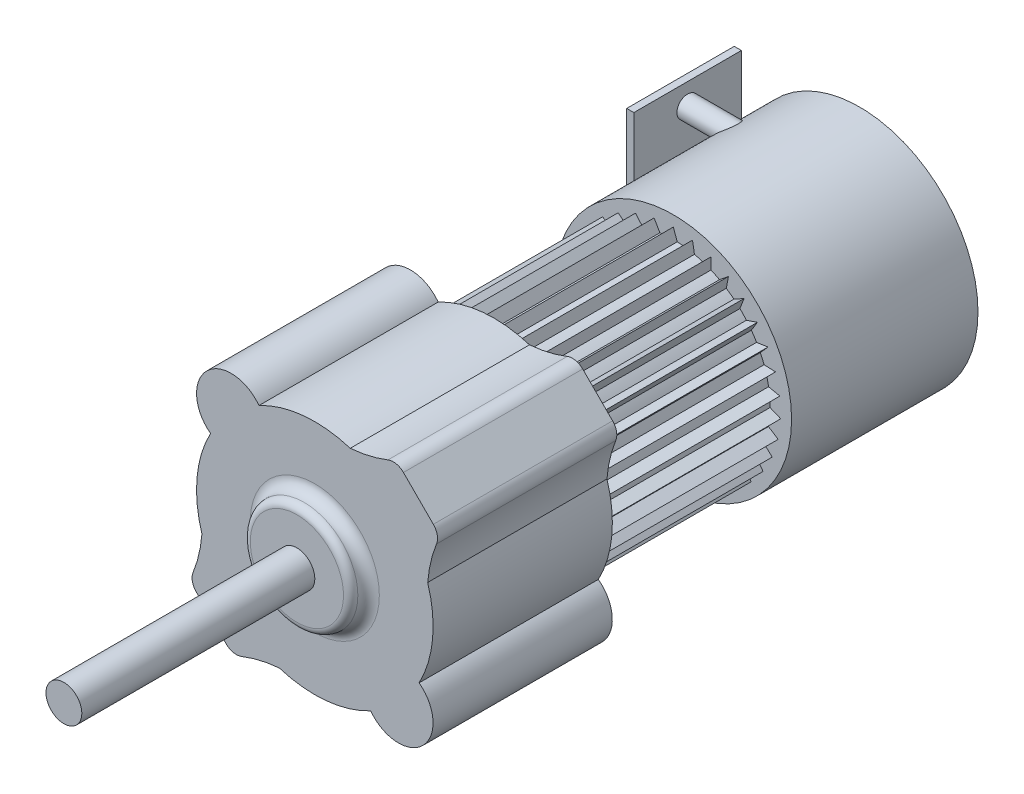
from build123d import *

# Parameters (mm, degrees)
BOSS_EXTRUDE1_DEPTH  = 25
FILLET1_R            = 2
BOSS_EXTRUDE2_DEPTH  = 25
BOSS_EXTRUDE5_START  = 26
SKETCH4_R            = 16.5
BOSS_EXTRUDE5_DEPTH  = 26
SKETCH6_W            = 1
SKETCH6_H            = 30.157972744
BOSS_EXTRUDE6_DEPTH  = 15
SKETCH7_R            = 1.5
BOSS_EXTRUDE9_DEPTH  = 15
SKETCH8_R            = 2.5
BOSS_EXTRUDE10_DEPTH = 35
SKETCH9_R            = 7.5
BOSS_EXTRUDE11_DEPTH = 2.5
FILLET2_R            = 1.5
FILLET3_R            = 1


with BuildPart() as part:
    # Sketch1 → Boss-Extrude1 (new body)
    with BuildSketch(Plane.XY):
        with BuildLine():
            Line((11.392014277, 17.5), (17.5, 11.392014277))
            add(Edge.make_bspline(
                [(17.5, 11.392014277), (16.021001263, 8.336734414), (15.743328656, 4.93939296)],
                knots=[0, 0, 0, 1, 1, 1], degree=2))
            ThreePointArc((15.743328656, 4.93939296), (16.427227325, -1.547967187), (14.54349702, -7.793375035))
            ThreePointArc((14.54349702, -7.793375035), (15.078986372, -15.078986372), (7.793375035, -14.54349702))
            ThreePointArc((7.793375035, -14.54349702), (1.547967187, -16.427227325), (-4.93939296, -15.743328656))
            add(Edge.make_bspline(
                [(-11.392014277, -17.5), (-8.336734414, -16.021001263), (-4.93939296, -15.743328656)],
                knots=[0, 0, 0, 1, 1, 1], degree=2))
            Line((-11.392014277, -17.5), (-17.5, -11.392014277))
            add(Edge.make_bspline(
                [(-17.5, -11.392014277), (-16.021001263, -8.336734414), (-15.743328656, -4.93939296)],
                knots=[0, 0, 0, 1, 1, 1], degree=2))
            ThreePointArc((-15.743328656, -4.93939296), (-16.427227325, 1.547967187), (-14.54349702, 7.793375035))
            ThreePointArc((-14.54349702, 7.793375035), (-15.078986372, 15.078986372), (-7.793375035, 14.54349702))
            ThreePointArc((-7.793375035, 14.54349702), (-1.547967187, 16.427227325), (4.93939296, 15.743328656))
            add(Edge.make_bspline(
                [(11.392014277, 17.5), (8.336734414, 16.021001263), (4.93939296, 15.743328656)],
                knots=[0, 0, 0, 1, 1, 1], degree=2))
        make_face()
    extrude(amount=BOSS_EXTRUDE1_DEPTH)

    # Fillet1
    fillet1_edges = [part.edges().sort_by_distance(p)[0] for p in [
        (-11.392014277, -17.5, 12.5),
        (-17.5, -11.392014277, 12.5),
        (17.5, 11.392014277, 12.5),
        (11.392014277, 17.5, 12.5),
    ]]
    fillet(fillet1_edges, radius=FILLET1_R)

    # Sketch3 → Boss-Extrude2 (add)
    with BuildSketch(Plane(origin=(0, 0, 0), x_dir=(-1, 0, 0), z_dir=(0, 0, -1))):
        with BuildLine():
            Line((-0.551967724, 13.488711267), (0, 15))
            Line((0, 15), (0.551967724, 13.488711267))
            ThreePointArc((0.551967724, 13.488711267), (1.21013067, 13.445652969), (1.865405023, 13.37049977))
            Line((1.865405023, 13.37049977), (2.678353422, 14.758943829))
            Line((2.678353422, 14.758943829), (2.951599775, 13.173384484))
            ThreePointArc((2.951599775, 13.173384484), (3.591497415, 13.013498619), (4.222822117, 12.82254941))
            Line((4.222822117, 12.82254941), (5.270622361, 14.04352306))
            Line((5.270622361, 14.04352306), (5.256364979, 12.434654286))
            ThreePointArc((5.256364979, 12.434654286), (5.857430478, 12.163079717), (6.444514235, 11.862471761))
            Line((6.444514235, 11.862471761), (7.693489161, 12.876731904))
            Line((7.693489161, 12.876731904), (7.392186289, 11.296264067))
            ThreePointArc((7.392186289, 11.296264067), (7.935100906, 10.921729424), (8.459074362, 10.521124509))
            Line((8.459074362, 10.521124509), (9.869080889, 11.29607199))
            Line((9.869080889, 11.29607199), (9.290416649, 9.794802627))
            ThreePointArc((9.290416649, 9.794802627), (9.757730662, 9.329345761), (10.201752879, 8.841619659))
            Line((10.201752879, 8.841619659), (11.727472237, 9.352347028))
            Line((11.727472237, 9.352347028), (10.890045373, 7.978528171))
            ThreePointArc((10.890045373, 7.978528171), (11.266738925, 7.43710925), (11.616538664, 6.877937878))
            Line((11.616538664, 6.877937878), (13.208932978, 7.108029937))
            Line((13.208932978, 7.108029937), (12.139659079, 5.905817254))
            ThreePointArc((12.139659079, 5.905817254), (12.413624929, 5.305837927), (12.657959339, 4.693193515))
            Line((12.657959339, 4.693193515), (14.265847744, 4.635254916))
            Line((14.265847744, 4.635254916), (12.999094154, 3.643288512))
            ThreePointArc((12.999094154, 3.643288512), (13.161526814, 3.004032608), (13.292542786, 2.35760605))
            Line((13.292542786, 2.35760605), (14.864246427, 2.013498987))
            Line((14.864246427, 2.013498987), (13.440727646, 1.26366148))
            ThreePointArc((13.440727646, 1.26366148), (13.486406398, 0.60567521), (13.49989297, -0.053756813))
            Line((13.49989297, -0.053756813), (14.984895998, -0.672972455))
            Line((14.984895998, -0.672972455), (13.450365093, -1.156580672))
            ThreePointArc((13.450365093, -1.156580672), (13.377821784, -1.812149089), (13.273345487, -2.463391888))
            Line((13.273345487, -2.463391888), (14.623918683, -3.337814009))
            Line((14.623918683, -3.337814009), (13.02769674, -3.53964937))
            ThreePointArc((13.02769674, -3.53964937), (12.83926297, -4.171729424), (12.620181758, -4.79385152))
            Line((12.620181758, -4.79385152), (13.792916588, -5.895375475))
            Line((13.792916588, -5.895375475), (12.186307493, -5.808950825))
            ThreePointArc((12.186307493, -5.808950825), (11.88803968, -6.397226943), (11.561395003, -6.970232821))
            Line((11.561395003, -6.970232821), (12.518598806, -8.263454722))
            Line((12.518598806, -8.263454722), (10.953240297, -7.89154782))
            ThreePointArc((10.953240297, -7.89154782), (10.554725013, -8.417112325), (10.131015501, -8.922585103))
            Line((10.131015501, -8.922585103), (10.841922957, -10.365939735))
            Line((10.841922957, -10.365939735), (9.368126945, -9.720503975))
            ThreePointArc((9.368126945, -9.720503975), (8.8821728, -10.166464791), (8.375016824, -10.588158159))
            Line((8.375016824, -10.588158159), (8.816778784, -12.135254916))
            Line((8.816778784, -12.135254916), (7.481914285, -11.237035135))
            ThreePointArc((7.481914285, -11.237035135), (6.924140245, -11.589058714), (6.349838216, -11.913419099))
            Line((6.349838216, -11.913419099), (6.508256087, -13.514533019))
            Line((6.508256087, -13.514533019), (5.355226744, -12.392398739))
            ThreePointArc((5.355226744, -12.392398739), (4.743560125, -12.639170754), (4.120570583, -12.855772947))
            Line((4.120570583, -12.855772947), (3.990552684, -14.45944291))
            Line((3.990552684, -14.45944291), (3.056417809, -13.149460452))
            ThreePointArc((3.056417809, -13.149460452), (2.41051808, -13.283049446), (1.758864421, -13.384931675))
            Line((1.758864421, -13.384931675), (1.344589634, -14.93961441))
            Line((1.344589634, -14.93961441), (0.659373091, -13.483887686))
            ThreePointArc((0.659373091, -13.483887686), (0, -13.5), (-0.659373091, -13.483887686))
            Line((-0.659373091, -13.483887686), (-1.344589634, -14.93961441))
            Line((-1.344589634, -14.93961441), (-1.758864421, -13.384931675))
            ThreePointArc((-1.758864421, -13.384931675), (-2.41051808, -13.283049446), (-3.056417809, -13.149460452))
            Line((-3.056417809, -13.149460452), (-3.990552684, -14.45944291))
            Line((-3.990552684, -14.45944291), (-4.120570583, -12.855772947))
            ThreePointArc((-4.120570583, -12.855772947), (-4.743560125, -12.639170754), (-5.355226744, -12.392398739))
            Line((-5.355226744, -12.392398739), (-6.508256087, -13.514533019))
            Line((-6.508256087, -13.514533019), (-6.349838216, -11.913419099))
            ThreePointArc((-6.349838216, -11.913419099), (-6.924140245, -11.589058714), (-7.481914285, -11.237035135))
            Line((-7.481914285, -11.237035135), (-8.816778784, -12.135254916))
            Line((-8.816778784, -12.135254916), (-8.375016824, -10.588158159))
            ThreePointArc((-8.375016824, -10.588158159), (-8.8821728, -10.166464791), (-9.368126945, -9.720503975))
            Line((-9.368126945, -9.720503975), (-10.841922957, -10.365939735))
            Line((-10.841922957, -10.365939735), (-10.131015501, -8.922585103))
            ThreePointArc((-10.131015501, -8.922585103), (-10.554725013, -8.417112325), (-10.953240297, -7.89154782))
            Line((-10.953240297, -7.89154782), (-12.518598806, -8.263454722))
            Line((-12.518598806, -8.263454722), (-11.561395003, -6.970232821))
            ThreePointArc((-11.561395003, -6.970232821), (-11.88803968, -6.397226943), (-12.186307493, -5.808950825))
            Line((-12.186307493, -5.808950825), (-13.792916588, -5.895375475))
            Line((-13.792916588, -5.895375475), (-12.620181758, -4.79385152))
            ThreePointArc((-12.620181758, -4.79385152), (-12.83926297, -4.171729424), (-13.02769674, -3.53964937))
            Line((-13.02769674, -3.53964937), (-14.623918683, -3.337814009))
            Line((-14.623918683, -3.337814009), (-13.273345487, -2.463391888))
            ThreePointArc((-13.273345487, -2.463391888), (-13.377821784, -1.812149089), (-13.450365093, -1.156580672))
            Line((-13.450365093, -1.156580672), (-14.984895998, -0.672972455))
            Line((-14.984895998, -0.672972455), (-13.49989297, -0.053756813))
            ThreePointArc((-13.49989297, -0.053756813), (-13.486406398, 0.60567521), (-13.440727646, 1.26366148))
            Line((-13.440727646, 1.26366148), (-14.864246427, 2.013498987))
            Line((-14.864246427, 2.013498987), (-13.292542786, 2.35760605))
            ThreePointArc((-13.292542786, 2.35760605), (-13.161526814, 3.004032608), (-12.999094154, 3.643288512))
            Line((-12.999094154, 3.643288512), (-14.265847744, 4.635254916))
            Line((-14.265847744, 4.635254916), (-12.657959339, 4.693193515))
            ThreePointArc((-12.657959339, 4.693193515), (-12.413624929, 5.305837927), (-12.139659079, 5.905817254))
            Line((-12.139659079, 5.905817254), (-13.208932978, 7.108029937))
            Line((-13.208932978, 7.108029937), (-11.616538664, 6.877937878))
            ThreePointArc((-11.616538664, 6.877937878), (-11.266738925, 7.43710925), (-10.890045373, 7.978528171))
            Line((-10.890045373, 7.978528171), (-11.727472237, 9.352347028))
            Line((-11.727472237, 9.352347028), (-10.201752879, 8.841619659))
            ThreePointArc((-10.201752879, 8.841619659), (-9.757730662, 9.329345761), (-9.290416649, 9.794802627))
            Line((-9.290416649, 9.794802627), (-9.869080889, 11.29607199))
            Line((-9.869080889, 11.29607199), (-8.459074362, 10.521124509))
            ThreePointArc((-8.459074362, 10.521124509), (-7.935100906, 10.921729424), (-7.392186289, 11.296264067))
            Line((-7.392186289, 11.296264067), (-7.693489161, 12.876731904))
            Line((-7.693489161, 12.876731904), (-6.444514235, 11.862471761))
            ThreePointArc((-6.444514235, 11.862471761), (-5.857430478, 12.163079717), (-5.256364979, 12.434654286))
            Line((-5.256364979, 12.434654286), (-5.270622361, 14.04352306))
            Line((-5.270622361, 14.04352306), (-4.222822117, 12.82254941))
            ThreePointArc((-4.222822117, 12.82254941), (-3.591497415, 13.013498619), (-2.951599775, 13.173384484))
            Line((-2.951599775, 13.173384484), (-2.678353422, 14.758943829))
            Line((-2.678353422, 14.758943829), (-1.865405023, 13.37049977))
            ThreePointArc((-1.865405023, 13.37049977), (-1.21013067, 13.445652969), (-0.551967724, 13.488711267))
        make_face()
    extrude(amount=BOSS_EXTRUDE2_DEPTH)

    # Sketch4 → Boss-Extrude5 (add)
    with BuildSketch(Plane(origin=(0, 0, -25), x_dir=(-1, 0, 0), z_dir=(0, 0, -1)).offset(BOSS_EXTRUDE5_START)):
        with Locations(Location((0, 0, 0), (0, 0, 180))):
            Circle(SKETCH4_R)
    extrude(amount=-BOSS_EXTRUDE5_DEPTH)

    # Sketch8 → Boss-Extrude10 (add)
    with BuildSketch(Plane.XY.offset(25)):
        Circle(SKETCH8_R)
    extrude(amount=BOSS_EXTRUDE10_DEPTH)

    # Sketch9 → Boss-Extrude11 (add)
    with BuildSketch(Plane.XY.offset(25)):
        Circle(SKETCH9_R)
    extrude(amount=BOSS_EXTRUDE11_DEPTH)

    # Fillet2
    fillet2_edges = [part.edges().sort_by_distance(p)[0] for p in [
        (-7.5, 0, 25),
    ]]
    fillet(fillet2_edges, radius=FILLET2_R)

    # Fillet3
    fillet3_edges = [part.edges().sort_by_distance(p)[0] for p in [
        (-7.5, 0, 27.5),
    ]]
    fillet(fillet3_edges, radius=FILLET3_R - 0.0001)  # a hair under: the kernel refuses the full size


with BuildPart() as body_2:
    # Sketch6 → Boss-Extrude6 (new body)
    with BuildSketch(Plane(origin=(0, 0, -51), x_dir=(-1, 0, 0), z_dir=(0, 0, -1))):
        with Locations((17, 0)):
            Rectangle(SKETCH6_W, SKETCH6_H)
    extrude(amount=-BOSS_EXTRUDE6_DEPTH)

    # Sketch7 → Boss-Extrude9 (add)
    with BuildSketch(Plane.ZY.offset(17.5)):
        with Locations((-43.5, 12.066195749)):
            Circle(SKETCH7_R)
        with Locations(Location((-43.5, -12.066195749, 0), (0, 0, 180))):
            Circle(SKETCH7_R)
    extrude(amount=-BOSS_EXTRUDE9_DEPTH)


solid = Compound([part.part, body_2.part])
